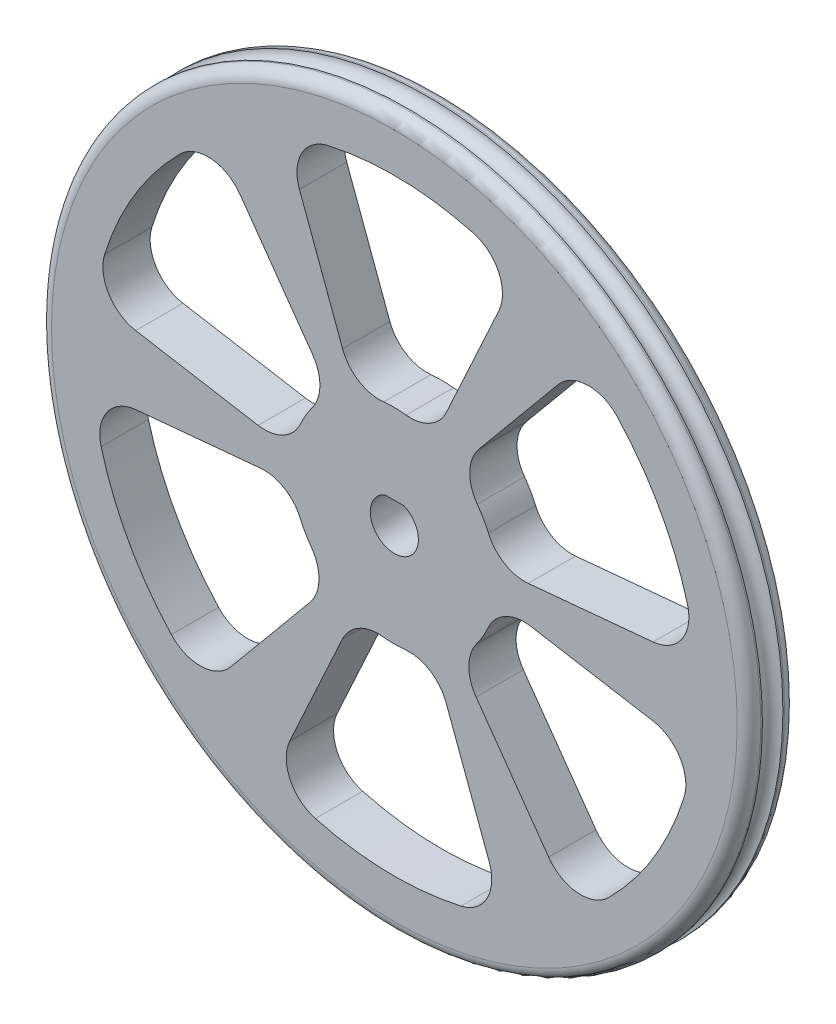
from build123d import *

# Parameters (mm, degrees)
ENL_V_MAT_EXTRU_3_DEPTH      = 64.710281815
ENL_V_MAT_EXTRU_3_DEPTH_BACK = 64.710281815
ENL_V_MAT_EXTRU_8_DEPTH      = 64.921827328
ENL_V_MAT_EXTRU_8_DEPTH_BACK = 64.921827328


with BuildPart() as part:
    # Esquisse2 → Révolution1 (revolve)
    with BuildSketch(Plane(origin=(0, 0, 0), x_dir=(0, 0, -1), z_dir=(1, 0, 0))):
        with BuildLine():
            Line((3, 0), (-3, 0))
            Line((-3, 0), (-3, 43.5))
            ThreePointArc((-3, 43.5), (-2.560660172, 44.560660172), (-1.5, 45))
            Line((-1.5, 45), (-1.3, 45))
            ThreePointArc((-1.3, 45), (0, 43.7), (1.3, 45))
            Line((1.3, 45), (1.5, 45))
            ThreePointArc((1.5, 45), (2.560660172, 44.560660172), (3, 43.5))
            Line((3, 43.5), (3, 0))
        make_face()
    revolve(axis=Axis((0, 0, 77.254476924), (0, 0, -1)))

    # Esquisse3 → Enlèv. mat.-Extru.3 (cut, two sides: drawn at the far end of the back side and taken through both)
    with BuildSketch(Plane.XY.offset(-ENL_V_MAT_EXTRU_3_DEPTH_BACK)):
        with BuildLine():
            Line((-1.209338662, 2.8), (1.209338662, 2.8))
            ThreePointArc((1.209338662, 2.8), (0, -3.05), (-1.209338662, 2.8))
        make_face()
    extrude(amount=ENL_V_MAT_EXTRU_3_DEPTH + ENL_V_MAT_EXTRU_3_DEPTH_BACK, mode=Mode.SUBTRACT)

    # Esquisse5 → Enlèv. mat.-Extru.8 (cut, two sides: drawn at the far end of the back side and taken through both)
    with BuildSketch(Plane.XY.offset(3).offset(-ENL_V_MAT_EXTRU_8_DEPTH_BACK)):
        with BuildLine():
            ThreePointArc((-8.455307606, 37.560055555), (-11.751783517, 35.067031665), (-12.045552926, 30.944457095))
            Line((-12.045552926, 30.944457095), (-6.567369781, 16.163985411))
            ThreePointArc((-6.567369781, 16.163985411), (-4.516458405, 13.65383338), (-1.357079074, 12.928972751))
            ThreePointArc((-1.357079074, 12.928972751), (0.071044011, 12.999805873), (1.498307609, 12.913368047))
            ThreePointArc((1.498307609, 12.913368047), (4.525990156, 13.522228989), (6.618452456, 15.793610677))
            Line((6.618452456, 15.793610677), (13.260872171, 30.259565767))
            ThreePointArc((13.260872171, 30.259565767), (13.243841863, 34.469137169), (10.018044179, 37.173764819))
            ThreePointArc((10.018044179, 37.173764819), (0.804886037, 38.491585554), (-8.455307606, 37.560055555))
        make_face()
        with BuildLine():
            ThreePointArc((11.932458581, 5.159111572), (13.973588898, 2.841492042), (16.986894292, 2.165057378))
            Line((16.986894292, 2.165057378), (32.835988747, 3.645530707))
            ThreePointArc((32.835988747, 3.645530707), (36.473069367, 5.765065087), (37.202446777, 9.911001654))
            ThreePointArc((37.202446777, 9.911001654), (33.73713394, 18.548741022), (28.300308475, 26.102538961))
            ThreePointArc((28.300308475, 26.102538961), (24.493048499, 27.710858898), (20.775909487, 25.903983384))
            Line((20.775909487, 25.903983384), (10.714737101, 13.769501772))
            ThreePointArc((10.714737101, 13.769501772), (9.566337363, 10.738284404), (10.51827931, 7.639751328))
            ThreePointArc((10.51827931, 7.639751328), (11.293684136, 6.438377019), (11.932458581, 5.159111572))
        make_face()
        with BuildLine():
            ThreePointArc((10.434150973, -7.754256475), (9.447598742, -10.680736947), (10.368441836, -13.6285533))
            Line((10.368441836, -13.6285533), (19.575116576, -26.61403506))
            ThreePointArc((19.575116576, -26.61403506), (23.229227503, -28.704072082), (27.184402598, -27.262763165))
            ThreePointArc((27.184402598, -27.262763165), (32.932247903, -19.942844532), (36.755616081, -11.457516594))
            ThreePointArc((36.755616081, -11.457516594), (36.244832016, -7.356172767), (32.821462414, -5.040473711))
            Line((32.821462414, -5.040473711), (17.282106883, -2.394483639))
            ThreePointArc((17.282106883, -2.394483639), (14.082795768, -2.915548976), (11.875358384, -5.289221422))
            ThreePointArc((11.875358384, -5.289221422), (11.222640125, -6.561428855), (10.434150973, -7.754256475))
        make_face()
        with BuildLine():
            ThreePointArc((-1.498307609, -12.913368047), (-4.525990156, -13.522228989), (-6.618452456, -15.793610677))
            Line((-6.618452456, -15.793610677), (-13.260872171, -30.259565767))
            ThreePointArc((-13.260872171, -30.259565767), (-13.243841863, -34.469137169), (-10.018044179, -37.173764819))
            ThreePointArc((-10.018044179, -37.173764819), (-0.804886037, -38.491585554), (8.455307606, -37.560055555))
            ThreePointArc((8.455307606, -37.560055555), (11.751783517, -35.067031665), (12.045552926, -30.944457095))
            Line((12.045552926, -30.944457095), (6.567369781, -16.163985411))
            ThreePointArc((6.567369781, -16.163985411), (4.516458405, -13.65383338), (1.357079074, -12.928972751))
            ThreePointArc((1.357079074, -12.928972751), (-0.071044011, -12.999805873), (-1.498307609, -12.913368047))
        make_face()
        with BuildLine():
            ThreePointArc((-11.932458581, -5.159111572), (-13.973588898, -2.841492042), (-16.986894292, -2.165057378))
            Line((-16.986894292, -2.165057378), (-32.835988747, -3.645530707))
            ThreePointArc((-32.835988747, -3.645530707), (-36.473069367, -5.765065087), (-37.202446777, -9.911001654))
            ThreePointArc((-37.202446777, -9.911001654), (-33.73713394, -18.548741022), (-28.300308475, -26.102538961))
            ThreePointArc((-28.300308475, -26.102538961), (-24.493048499, -27.710858898), (-20.775909487, -25.903983384))
            Line((-20.775909487, -25.903983384), (-10.714737101, -13.769501772))
            ThreePointArc((-10.714737101, -13.769501772), (-9.566337363, -10.738284404), (-10.51827931, -7.639751328))
            ThreePointArc((-10.51827931, -7.639751328), (-11.293684136, -6.438377019), (-11.932458581, -5.159111572))
        make_face()
        with BuildLine():
            ThreePointArc((-10.434150973, 7.754256475), (-9.447598742, 10.680736947), (-10.368441836, 13.6285533))
            Line((-10.368441836, 13.6285533), (-19.575116576, 26.61403506))
            ThreePointArc((-19.575116576, 26.61403506), (-23.229227503, 28.704072082), (-27.184402598, 27.262763165))
            ThreePointArc((-27.184402598, 27.262763165), (-32.932247903, 19.942844532), (-36.755616081, 11.457516594))
            ThreePointArc((-36.755616081, 11.457516594), (-36.244832016, 7.356172767), (-32.821462414, 5.040473711))
            Line((-32.821462414, 5.040473711), (-17.282106883, 2.394483639))
            ThreePointArc((-17.282106883, 2.394483639), (-14.082795768, 2.915548976), (-11.875358384, 5.289221422))
            ThreePointArc((-11.875358384, 5.289221422), (-11.222640125, 6.561428855), (-10.434150973, 7.754256475))
        make_face()
    extrude(amount=ENL_V_MAT_EXTRU_8_DEPTH + ENL_V_MAT_EXTRU_8_DEPTH_BACK, mode=Mode.SUBTRACT)


solid = part.part
